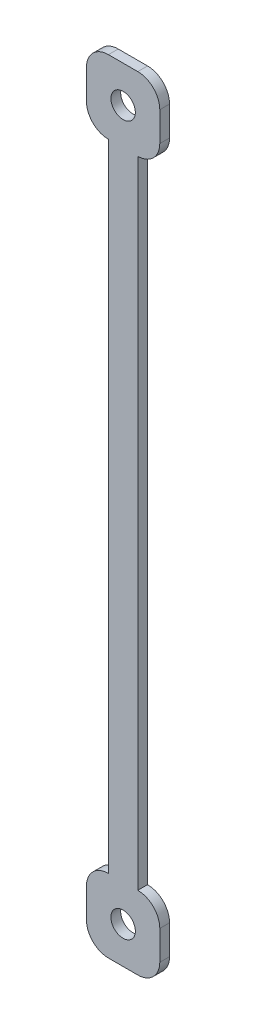
from build123d import *

# Parameters (mm, degrees)
SKETCH_1_R      = 2.5
EXTRUDE_1_DEPTH = 2
FILLET_1_R      = 4.5


with BuildPart() as part:
    # 草图1 → 凸台-拉伸1 (new body)
    with BuildSketch(Plane.XY):
        Polygon((-7.5, 7.5), (-7.5, -7.5), (-3, -7.5), (-3, -137.5), (-7.5, -137.5), (-7.5, -152.5), (7.5, -152.5), (7.5, -137.5), (3, -137.5), (3, -7.5), (7.5, -7.5), (7.5, 7.5), align=None)
        Circle(SKETCH_1_R, mode=Mode.SUBTRACT)
        with Locations((0, -145)):
            Circle(SKETCH_1_R, mode=Mode.SUBTRACT)
    extrude(amount=EXTRUDE_1_DEPTH)

    # 圆角1
    fillet_1_edges = [part.edges().sort_by_distance(p)[0] for p in [
        (-7.5, 7.5, 1),
        (-7.5, -7.5, 1),
        (7.5, -7.5, 1),
        (7.5, 7.5, 1),
        (7.5, -152.5, 1),
        (7.5, -137.5, 1),
        (-7.5, -152.5, 1),
        (-7.5, -137.5, 1),
    ]]
    fillet(fillet_1_edges, radius=FILLET_1_R - 0.0001)  # a hair under: the kernel refuses the full size


solid = part.part
